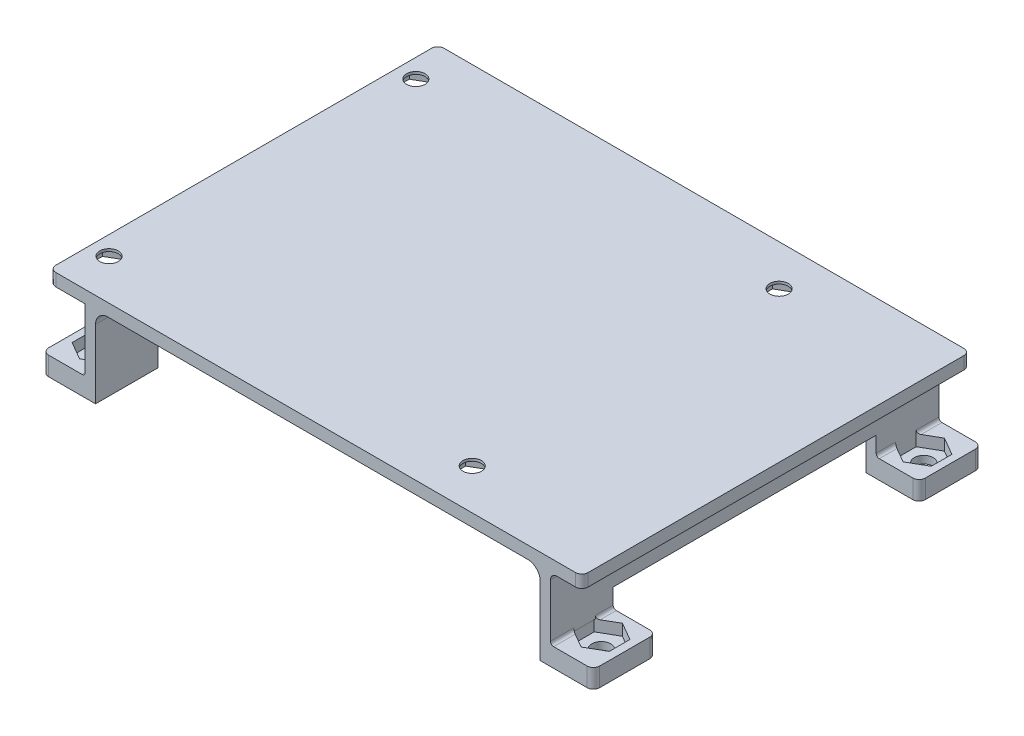
from build123d import *

# Parameters (mm, degrees)
EXTRUDE_1_DEPTH          = 31
CUT_EXTRUDE_1_DEPTH      = 56.874860179
CUT_EXTRUDE_1_DEPTH_BACK = 56.874860179
SKETCH_2_W               = 42
SKETCH_2_H               = 12
CUT_EXTRUDE_4_REACH      = 57.875
SKETCH_3_R               = 1.5
SKETCH_5_R               = 1.475
CUT_EXTRUDE_5_DEPTH      = 5
CUT_EXTRUDE_8_DEPTH      = 1.6
FILLET_1_R               = 1
FILLET_7_R               = 2
CUT_EXTRUDE_9_DEPTH      = 1.8
FILLET_5_R               = 0.5
FILLET_8_R               = 1


with BuildPart() as part:
    # 草圖1 → 填料-伸長1 (new, symmetric)
    with BuildSketch(Plane.XY):
        Polygon((-44, 0), (-44, 3), (-37.15, 3), (-37.15, 13), (-42.85, 13), (-42.85, 15), (42.15, 15), (42.15, 13), (37.15, 13), (37.15, 3), (44, 3), (44, 0), (35.5, 0), (35.5, 13), (-35.5, 13), (-35.5, 0), align=None)
    extrude(amount=EXTRUDE_1_DEPTH, both=True)

    # 草圖2 → 除料-伸長1 (cut, two sides: drawn at the far end of the back side and taken through both)
    with BuildSketch(Plane(origin=(0, 0, 0), x_dir=(0, 0, -1), z_dir=(1, 0, 0)).offset(-CUT_EXTRUDE_1_DEPTH_BACK)):
        Rectangle(SKETCH_2_W, SKETCH_2_H)
    extrude(amount=CUT_EXTRUDE_1_DEPTH + CUT_EXTRUDE_1_DEPTH_BACK, mode=Mode.SUBTRACT)

    # 草圖3 → 除料-伸長4 (cut, up to next)
    with BuildSketch(Plane(origin=(0, 0, 0), x_dir=(1, 0, 0), z_dir=(0, 1, 0)), mode=Mode.PRIVATE) as cut_extrude_4_sk1:
        with Locations((-40, 25.75)):
            Circle(SKETCH_3_R)
    cut_extrude_4_tool1 = extrude(cut_extrude_4_sk1.sketch, amount=CUT_EXTRUDE_4_REACH, mode=Mode.PRIVATE) & part.part
    # 草圖3 → 除料-伸長4 (cut, up to next)
    with BuildSketch(Plane(origin=(0, 0, 0), x_dir=(1, 0, 0), z_dir=(0, 1, 0)), mode=Mode.PRIVATE) as cut_extrude_4_sk2:
        with Locations((40, 25.75)):
            Circle(SKETCH_3_R)
    cut_extrude_4_tool2 = extrude(cut_extrude_4_sk2.sketch, amount=CUT_EXTRUDE_4_REACH, mode=Mode.PRIVATE) & part.part
    # 草圖3 → 除料-伸長4 (cut, up to next)
    with BuildSketch(Plane(origin=(0, 0, 0), x_dir=(1, 0, 0), z_dir=(0, 1, 0)), mode=Mode.PRIVATE) as cut_extrude_4_sk3:
        with Locations((40, -25.75)):
            Circle(SKETCH_3_R)
    cut_extrude_4_tool3 = extrude(cut_extrude_4_sk3.sketch, amount=CUT_EXTRUDE_4_REACH, mode=Mode.PRIVATE) & part.part
    # 草圖3 → 除料-伸長4 (cut, up to next)
    with BuildSketch(Plane(origin=(0, 0, 0), x_dir=(1, 0, 0), z_dir=(0, 1, 0)), mode=Mode.PRIVATE) as cut_extrude_4_sk4:
        with Locations((-40, -25.75)):
            Circle(SKETCH_3_R)
    cut_extrude_4_tool4 = extrude(cut_extrude_4_sk4.sketch, amount=CUT_EXTRUDE_4_REACH, mode=Mode.PRIVATE) & part.part
    add(cut_extrude_4_tool1.solids().sort_by_distance((-40, 0, -25.75))[0], mode=Mode.SUBTRACT)
    add(cut_extrude_4_tool2.solids().sort_by_distance((40, 0, -25.75))[0], mode=Mode.SUBTRACT)
    add(cut_extrude_4_tool3.solids().sort_by_distance((40, 0, 25.75))[0], mode=Mode.SUBTRACT)
    add(cut_extrude_4_tool4.solids().sort_by_distance((-40, 0, 25.75))[0], mode=Mode.SUBTRACT)

    # 草圖5 → 除料-伸長5 (cut)
    with BuildSketch(Plane(origin=(0, 15, 0), x_dir=(1, 0, 0), z_dir=(0, 1, 0))):
        with Locations((-39.85, 24.5)):
            Circle(SKETCH_5_R)
        with Locations((-39.85, -24.5)):
            Circle(SKETCH_5_R)
        with Locations((18.15, 24.5)):
            Circle(SKETCH_5_R)
        with Locations((18.15, -24.5)):
            Circle(SKETCH_5_R)
    extrude(amount=-CUT_EXTRUDE_5_DEPTH, mode=Mode.SUBTRACT)

    # 草圖17 → 除料-伸長8 (cut)
    with BuildSketch(Plane.XZ.offset(-13)):
        Polygon((20.65, 23.056624327), (20.65, 25.943375673), (18.15, 27.386751346), (15.65, 25.943375673), (15.65, 23.056624327), (18.15, 21.613248654), align=None)
        Polygon((20.65, -25.943375673), (20.65, -23.056624327), (18.15, -21.613248654), (15.65, -23.056624327), (15.65, -25.943375673), (18.15, -27.386751346), align=None)
        Polygon((-39.85, 21.613248654), (-37.35, 23.056624327), (-37.35, 25.943375673), (-39.85, 27.386751346), (-42.35, 25.943375673), (-42.35, 23.056624327), align=None)
        Polygon((-39.85, -27.386751346), (-37.35, -25.943375673), (-37.35, -23.056624327), (-39.85, -21.613248654), (-42.35, -23.056624327), (-42.35, -25.943375673), align=None)
    extrude(amount=-CUT_EXTRUDE_8_DEPTH, mode=Mode.SUBTRACT)

    # 圓角1
    fillet_1_edges = [part.edges().sort_by_distance(p)[0] for p in [
        (42.15, 14, -31),
        (44, 1.5, -31),
        (44, 1.5, -21),
        (44, 1.5, 21),
        (44, 1.5, 31),
        (42.15, 14, 31),
        (-42.85, 14, -31),
        (-44, 1.5, -31),
        (-44, 1.5, -21),
        (-44, 1.5, 21),
        (-44, 1.5, 31),
        (-42.85, 14, 31),
    ]]
    fillet(fillet_1_edges, radius=FILLET_1_R)

    # 圓角7
    fillet_7_edges = [part.edges().sort_by_distance(p)[0] for p in [
        (35.5, 13, 0),
        (-35.5, 13, 0),
    ]]
    fillet(fillet_7_edges, radius=FILLET_7_R)

    # 草圖19 → 除料-伸長9 (cut)
    with BuildSketch(Plane(origin=(0, 3, 0), x_dir=(1, 0, 0), z_dir=(0, 1, 0))):
        Polygon((-40, -29.040896534), (-37.15, -27.395448267), (-37.15, -24.104551733), (-40, -22.459103466), (-42.85, -24.104551733), (-42.85, -27.395448267), align=None)
        Polygon((39.896071136, -28.850899892), (42.746071136, -27.205451625), (42.746071136, -23.91455509), (39.896071136, -22.269106823), (37.046071136, -23.91455509), (37.046071136, -27.205451625), align=None)
        Polygon((42.85, 24.104551733), (42.85, 27.395448267), (40, 29.040896534), (37.15, 27.395448267), (37.15, 24.104551733), (40, 22.459103466), align=None)
        Polygon((-40, 22.459103466), (-37.15, 24.104551733), (-37.15, 27.395448267), (-40, 29.040896534), (-42.85, 27.395448267), (-42.85, 24.104551733), align=None)
    extrude(amount=-CUT_EXTRUDE_9_DEPTH, mode=Mode.SUBTRACT)

    # 圓角5
    fillet_5_edges = [part.edges().sort_by_distance(p)[0] for p in [
        (37.15, 3, -22.552275866),
        (37.15, 3, -29.197724134),
        (37.15, 3, 29.132727491),
        (37.15, 3, 22.427275866),
        (-37.15, 3, -22.552275866),
        (-37.15, 3, -29.197724134),
        (-37.15, 3, 22.552275866),
        (-37.15, 3, 29.197724134),
    ]]
    fillet(fillet_5_edges, radius=FILLET_5_R)

    # 圓角8
    fillet_8_edges = [part.edges().sort_by_distance(p)[0] for p in [
        (37.15, 13, 0),
    ]]
    fillet(fillet_8_edges, radius=FILLET_8_R)


solid = part.part
